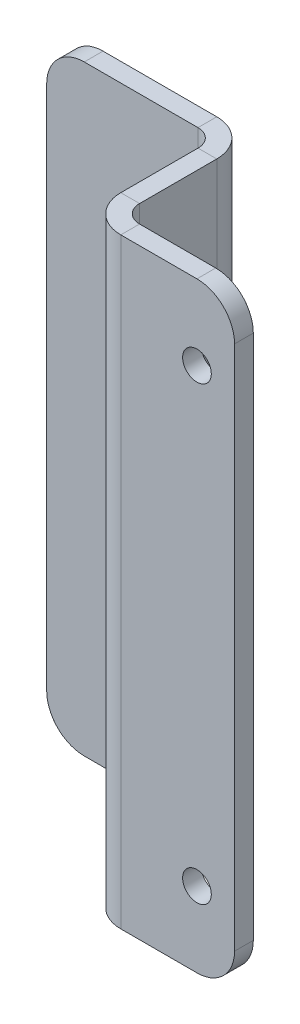
from build123d import *

# Parameters (mm, degrees)
SKETCH1_W                    = 25.4
SKETCH1_H                    = 101.6
BASE_FLANGE1_DEPTH           = 3.175
EDGE_FLANGE1_STRIP_W         = 18.7
EDGE_FLANGE1_STRIP_H         = 3.175
EDGE_FLANGE1_STRIP_CUT_DEPTH = 101.6
EDGE_FLANGE1_DEPTH           = 101.6
EDGE_FLANGE2_STRIP_W         = 18.7
EDGE_FLANGE2_STRIP_H         = 3.175
EDGE_FLANGE2_STRIP_CUT_DEPTH = 101.6
EDGE_FLANGE2_DEPTH           = 101.6
F_11_0_191_DIAMETER_HOLE1_D  = 4.8514
FILLET1_R                    = 6.35


# Sheet-metal steps are written as plain solids
with BuildPart() as part:
    # Sketch1 → Base-Flange1 (new body)
    with BuildSketch(Plane.XY):
        with Locations((-12.7, -50.8)):
            Rectangle(SKETCH1_W, SKETCH1_H)
    extrude(amount=-BASE_FLANGE1_DEPTH)

    # Edge-Flange1 strip (across the edge) → Edge-Flange1 strip cut (cut)
    with BuildSketch(Plane(origin=(-25.4, -101.6, -3.175), x_dir=(1, 0, 0), z_dir=(0, 1, 0))):
        with Locations((-3.175, -1.5875)):
            Rectangle(EDGE_FLANGE1_STRIP_W, EDGE_FLANGE1_STRIP_H)
    extrude(amount=EDGE_FLANGE1_STRIP_CUT_DEPTH, mode=Mode.SUBTRACT)

    # Edge-Flange1 section (across the edge) → Edge-Flange1 (add)
    with BuildSketch(Plane(origin=(-25.4, -101.6, -3.175), x_dir=(1, 0, 0), z_dir=(0, 1, 0))):
        with BuildLine():
            Line((0, 3), (0, 19.05))
            Line((0, 19.05), (3.175, 19.05))
            Line((3.175, 19.05), (3.175, 3))
            ThreePointArc((3.175, 3), (4.053679656, 0.878679656), (6.175, 0))
            Line((6.175, 0), (6.175, -3.175))
            ThreePointArc((6.175, -3.175), (1.808615626, -1.366384374), (0, 3))
        make_face()
    extrude(amount=EDGE_FLANGE1_DEPTH)

    # Edge-Flange2 strip (across the edge) → Edge-Flange2 strip cut (cut)
    with BuildSketch(Plane(origin=(-25.4, 0, -22.225), x_dir=(0, 0, 1), z_dir=(0, -1, 0))):
        with Locations((-6.35, -1.5875)):
            Rectangle(EDGE_FLANGE2_STRIP_W, EDGE_FLANGE2_STRIP_H)
    extrude(amount=EDGE_FLANGE2_STRIP_CUT_DEPTH, mode=Mode.SUBTRACT)

    # Edge-Flange2 section (across the edge) → Edge-Flange2 (add)
    with BuildSketch(Plane(origin=(-25.4, 0, -22.225), x_dir=(0, 0, 1), z_dir=(0, -1, 0))):
        with BuildLine():
            Line((-3.175, 3), (-3.175, 28.575))
            Line((-3.175, 28.575), (0, 28.575))
            Line((0, 28.575), (0, 3))
            ThreePointArc((0, 3), (0.878679656, 0.878679656), (3, 0))
            Line((3, 0), (3, -3.175))
            ThreePointArc((3, -3.175), (-1.366384374, -1.366384374), (-3.175, 3))
        make_face()
    extrude(amount=EDGE_FLANGE2_DEPTH)

    # #11 (0.191) Diameter Hole1 (through all)
    with Locations(Plane.XY):
        with Locations((-6.35, -12.7), (-6.35, -88.9)):
            Hole(F_11_0_191_DIAMETER_HOLE1_D / 2)

    # Fillet1
    fillet1_edges = [part.edges().sort_by_distance(p)[0] for p in [
        (-53.975, 0, -23.8125),
        (-53.975, -101.6, -23.8125),
        (0, -101.6, -1.5875),
        (0, 0, -1.5875),
    ]]
    fillet(fillet1_edges, radius=FILLET1_R)


solid = part.part
